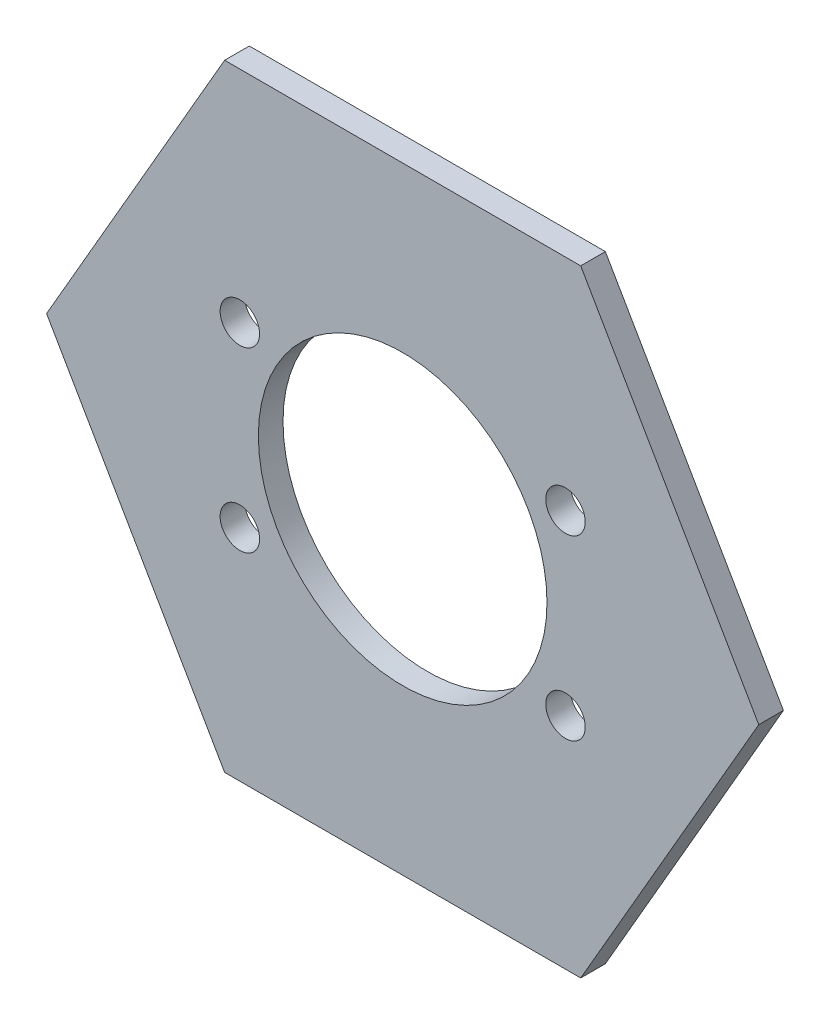
from build123d import *

# Parameters (mm, degrees)
SKETCH1_R           = 11.7
SKETCH1_R_2         = 1.6
BOSS_EXTRUDE1_DEPTH = 2


with BuildPart() as part:
    # Sketch1 → Boss-Extrude1 (new body)
    with BuildSketch(Plane.XY):
        Polygon((-14.43375673, 25), (14.43375673, 25), (28.867513459, 0), (14.43375673, -25), (-14.43375673, -25), (-28.867513459, 0), align=None)
        Circle(SKETCH1_R, mode=Mode.SUBTRACT)
        with Locations((-13.2, -7.2)):
            Circle(SKETCH1_R_2, mode=Mode.SUBTRACT)
        with Locations((-13.2, 7.2)):
            Circle(SKETCH1_R_2, mode=Mode.SUBTRACT)
        with Locations((13.2, 7.2)):
            Circle(SKETCH1_R_2, mode=Mode.SUBTRACT)
        with Locations((13.2, -7.2)):
            Circle(SKETCH1_R_2, mode=Mode.SUBTRACT)
    extrude(amount=BOSS_EXTRUDE1_DEPTH)


solid = part.part
